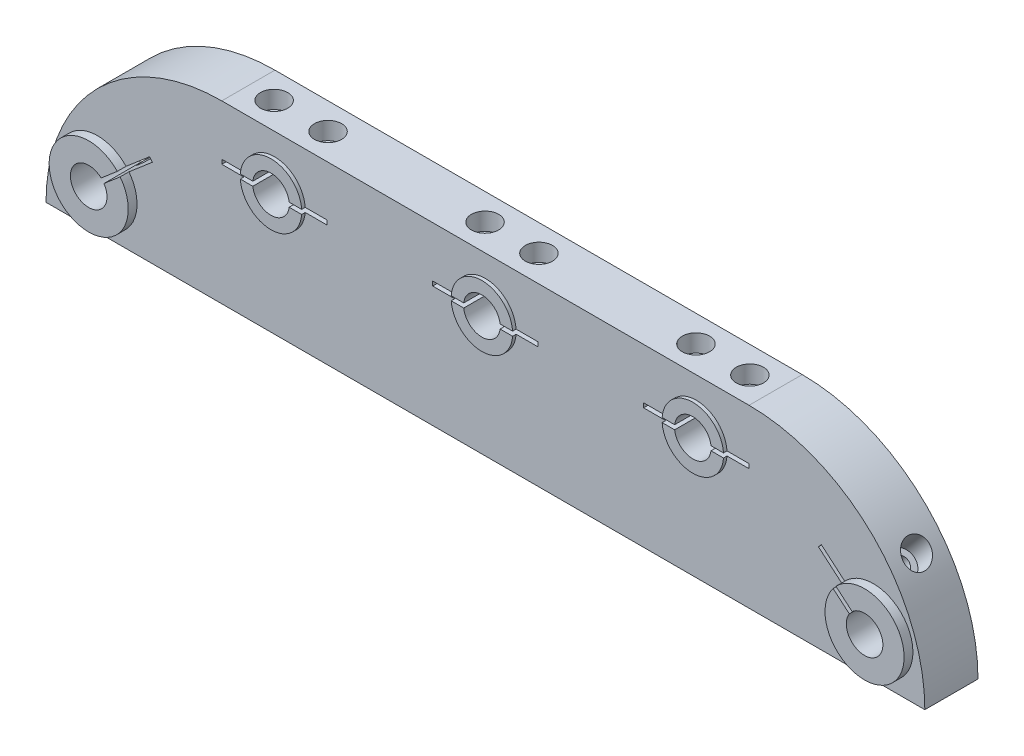
from build123d import *

# Parameters (mm, degrees)
SKETCH1_R                      = 4.165
BOSS_EXTRUDE1_DEPTH            = 12.1
SKETCH2_R                      = 7
SKETCH2_R_2                    = 4.165
BOSS_EXTRUDE3_DEPTH            = 0.8
SKETCH4_R                      = 9
SKETCH4_R_2                    = 4.165
BOSS_EXTRUDE4_DEPTH            = 2
CUT_EXTRUDE2_DEPTH             = 103.950522097
CUT_EXTRUDE2_DEPTH_BACK        = 103.950522097
SKETCH6_W                      = 24
SKETCH6_H                      = 1
CUT_EXTRUDE3_DEPTH             = 105.666422505
CUT_EXTRUDE3_DEPTH_BACK        = 105.666422505
SKETCH8_R                      = 1.6
CUT_EXTRUDE4_REACH             = 146.593
SKETCH9_R                      = 1.75
CUT_EXTRUDE4_DIRECTION_2_REACH = 146.593
CUT_EXTRUDE5_REACH             = 146.593
SKETCH10_R                     = 1.75
CUT_EXTRUDE5_DIRECTION_2_REACH = 146.593
SKETCH11_R                     = 3.1
CUT_EXTRUDE6_DEPTH             = 4
SKETCH12_R                     = 3.7
CUT_EXTRUDE7_DEPTH             = 20
CUT_EXTRUDE8_REACH             = 153.791
SKETCH13_R                     = 3.1
CUT_EXTRUDE9_REACH             = 140.366
SKETCH14_R                     = 3.6
CUT_EXTRUDE10_REACH            = 140.366
SKETCH15_R                     = 3.6
CUT_EXTRUDE11_REACH            = 153.791
SKETCH16_R                     = 3.1


with BuildPart() as part:
    # Sketch1 → Boss-Extrude1 (new body)
    with BuildSketch(Plane.XY):
        with BuildLine():
            Line((-60, 20), (60, 20))
            ThreePointArc((60, 20), (88.284271247, 8.284271247), (100, -20))
            Line((100, -20), (-100, -20))
            ThreePointArc((-100, -20), (-88.284271247, 8.284271247), (-60, 20))
        make_face()
        with Locations((0, 8)):
            Circle(SKETCH1_R, mode=Mode.SUBTRACT)
        with Locations((48, 8)):
            Circle(SKETCH1_R, mode=Mode.SUBTRACT)
        with Locations((-48, 8)):
            Circle(SKETCH1_R, mode=Mode.SUBTRACT)
        with Locations((-88.284271247, -10)):
            Circle(SKETCH1_R, mode=Mode.SUBTRACT)
        with Locations((88.284271247, -10)):
            Circle(SKETCH1_R, mode=Mode.SUBTRACT)
    extrude(amount=BOSS_EXTRUDE1_DEPTH)

    # Sketch2 → Boss-Extrude3 (add)
    # profile 1 of 3: a face of its own
    with BuildSketch(Plane.XY.offset(12.1)):
        with Locations((-48, 8)):
            Circle(SKETCH2_R)
        with Locations((-48, 8)):
            Circle(SKETCH2_R_2, mode=Mode.SUBTRACT)
    # profile 2 of 3: a face of its own
    with BuildSketch(Plane.XY.offset(12.1)):
        with Locations((0, 8)):
            Circle(SKETCH2_R)
        with Locations((0, 8)):
            Circle(SKETCH2_R_2, mode=Mode.SUBTRACT)
    # profile 3 of 3: a face of its own
    with BuildSketch(Plane.XY.offset(12.1)):
        with Locations((48, 8)):
            Circle(SKETCH2_R)
        with Locations((48, 8)):
            Circle(SKETCH2_R_2, mode=Mode.SUBTRACT)
    extrude(amount=BOSS_EXTRUDE3_DEPTH)

    # Sketch4 → Boss-Extrude4 (add)
    # profile 1 of 2: a face of its own
    with BuildSketch(Plane.XY.offset(12.1)):
        with Locations((-88.284271247, -10)):
            Circle(SKETCH4_R)
        with Locations((-88.284271247, -10)):
            Circle(SKETCH4_R_2, mode=Mode.SUBTRACT)
    # profile 2 of 2: a face of its own
    with BuildSketch(Plane.XY.offset(12.1)):
        with Locations((88.284271247, -10)):
            Circle(SKETCH4_R)
        with Locations((88.284271247, -10)):
            Circle(SKETCH4_R_2, mode=Mode.SUBTRACT)
    extrude(amount=BOSS_EXTRUDE4_DEPTH)

    # Sketch6 → Cut-Extrude2 (cut, two sides: drawn at the far end of the back side and taken through both)
    with BuildSketch(Plane(origin=(0, 0, 0), x_dir=(-1, 0, 0), z_dir=(0, 0, -1)).offset(-CUT_EXTRUDE2_DEPTH_BACK)):
        Polygon((87.959663189, -10.380301996), (88.608879306, -9.619698004), (76.439215423, 0.767759866), (75.789999307, 0.007155873), align=None)
        Polygon((-88.608879306, -9.619698004), (-87.959663189, -10.380301996), (-75.789999307, 0.007155873), (-76.439215423, 0.767759866), align=None)
        with Locations((-48, 8)):
            Rectangle(SKETCH6_W, SKETCH6_H)
        with Locations((0, 8)):
            Rectangle(SKETCH6_W, SKETCH6_H)
        with Locations((48, 8)):
            Rectangle(SKETCH6_W, SKETCH6_H)
    extrude(amount=CUT_EXTRUDE2_DEPTH + CUT_EXTRUDE2_DEPTH_BACK, mode=Mode.SUBTRACT)

    # Sketch8 → Cut-Extrude3 (cut, two sides: drawn at the far end of the back side and taken through both)
    with BuildSketch(Plane(origin=(0, 7.5, 0), x_dir=(1, 0, 0), z_dir=(0, 1, 0)).offset(-CUT_EXTRUDE3_DEPTH_BACK)):
        with Locations((54.134879079, -6.05)):
            Circle(SKETCH8_R)
        with Locations((41.865120921, -6.05)):
            Circle(SKETCH8_R)
        with Locations((6.134879079, -6.05)):
            Circle(SKETCH8_R)
        with Locations((-41.865120921, -6.05)):
            Circle(SKETCH8_R)
        with Locations((-6.134879079, -6.05)):
            Circle(SKETCH8_R)
        with Locations((-54.134879079, -6.05)):
            Circle(SKETCH8_R)
    extrude(amount=CUT_EXTRUDE3_DEPTH + CUT_EXTRUDE3_DEPTH_BACK, mode=Mode.SUBTRACT)

    # Sketch9 → Cut-Extrude4 (cut, up to next)
    with BuildSketch(Plane(origin=(31.947621166, 37.428966387, 0), x_dir=(0.76060399265734, -0.6492161168314546, 0), z_dir=(0.6492161168314546, 0.76060399265734, 0)), mode=Mode.PRIVATE) as cut_extrude4_sk1:
        with Locations((67.506651289, -6.05)):
            Circle(SKETCH9_R)
    cut_extrude4_tool1 = extrude(cut_extrude4_sk1.sketch, amount=-CUT_EXTRUDE4_REACH, mode=Mode.PRIVATE) & part.part
    add(cut_extrude4_tool1.solids().sort_by_distance((83.29345, -6.39744, 6.05))[0], mode=Mode.SUBTRACT)

    # Sketch9 → Cut-Extrude4 direction 2 (cut, up to next)
    with BuildSketch(Plane(origin=(31.947621166, 37.428966387, 0), x_dir=(0.76060399265734, -0.6492161168314546, 0), z_dir=(0.6492161168314546, 0.76060399265734, 0)), mode=Mode.PRIVATE) as cut_extrude4_direction_2_sk1:
        with Locations((67.506651289, -6.05)):
            Circle(SKETCH9_R)
    cut_extrude4_direction_2_tool1 = extrude(cut_extrude4_direction_2_sk1.sketch, amount=CUT_EXTRUDE4_DIRECTION_2_REACH, mode=Mode.PRIVATE) & part.part
    add(cut_extrude4_direction_2_tool1.solids().sort_by_distance((83.29345, -6.39744, 6.05))[0], mode=Mode.SUBTRACT)

    # Sketch10 → Cut-Extrude5 (cut, up to next)
    with BuildSketch(Plane(origin=(-31.947621166, 37.428966387, 0), x_dir=(0.7606039926573399, 0.6492161168314549, 0), z_dir=(-0.6492161168314549, 0.7606039926573399, 0)), mode=Mode.PRIVATE) as cut_extrude5_sk1:
        with Locations((-67.506651289, -6.05)):
            Circle(SKETCH10_R)
    cut_extrude5_tool1 = extrude(cut_extrude5_sk1.sketch, amount=-CUT_EXTRUDE5_REACH, mode=Mode.PRIVATE) & part.part
    add(cut_extrude5_tool1.solids().sort_by_distance((-83.29345, -6.39744, 6.05))[0], mode=Mode.SUBTRACT)

    # Sketch10 → Cut-Extrude5 direction 2 (cut, up to next)
    with BuildSketch(Plane(origin=(-31.947621166, 37.428966387, 0), x_dir=(0.7606039926573399, 0.6492161168314549, 0), z_dir=(-0.6492161168314549, 0.7606039926573399, 0)), mode=Mode.PRIVATE) as cut_extrude5_direction_2_sk1:
        with Locations((-67.506651289, -6.05)):
            Circle(SKETCH10_R)
    cut_extrude5_direction_2_tool1 = extrude(cut_extrude5_direction_2_sk1.sketch, amount=CUT_EXTRUDE5_DIRECTION_2_REACH, mode=Mode.PRIVATE) & part.part
    add(cut_extrude5_direction_2_tool1.solids().sort_by_distance((-83.29345, -6.39744, 6.05))[0], mode=Mode.SUBTRACT)

    # Sketch11 → Cut-Extrude6 (cut)
    with BuildSketch(Plane(origin=(0, 20, 0), x_dir=(1, 0, 0), z_dir=(0, 1, 0))):
        with Locations((-54.134879079, -6.05)):
            Circle(SKETCH11_R)
        with Locations((-41.865120921, -6.05)):
            Circle(SKETCH11_R)
        with Locations((-6.134879079, -6.05)):
            Circle(SKETCH11_R)
        with Locations((6.134879079, -6.05)):
            Circle(SKETCH11_R)
        with Locations((41.865120921, -6.05)):
            Circle(SKETCH11_R)
        with Locations((54.134879079, -6.05)):
            Circle(SKETCH11_R)
    extrude(amount=-CUT_EXTRUDE6_DEPTH, mode=Mode.SUBTRACT)

    # Sketch12 → Cut-Extrude7 (cut)
    with BuildSketch(Plane.XZ.offset(20)):
        with Locations((-54.134879079, 6.05)):
            Circle(SKETCH12_R)
        with Locations((-41.865120921, 6.05)):
            Circle(SKETCH12_R)
        with Locations((-6.134879079, 6.05)):
            Circle(SKETCH12_R)
        with Locations((6.134879079, 6.05)):
            Circle(SKETCH12_R)
        with Locations((41.865120921, 6.05)):
            Circle(SKETCH12_R)
        with Locations((54.134879079, 6.05)):
            Circle(SKETCH12_R)
    extrude(amount=-CUT_EXTRUDE7_DEPTH, mode=Mode.SUBTRACT)

    # Sketch13 → Cut-Extrude8 (cut, up to next)
    with BuildSketch(Plane(origin=(-37.1413501, 43.513798328, 0), x_dir=(-0.76060399265734, -0.6492161168314547, 0), z_dir=(0.6492161168314547, -0.76060399265734, 0)), mode=Mode.PRIVATE) as cut_extrude8_sk1:
        with Locations((67.506651289, -6.05)):
            Circle(SKETCH13_R)
    cut_extrude8_tool1 = extrude(cut_extrude8_sk1.sketch, amount=-CUT_EXTRUDE8_REACH, mode=Mode.PRIVATE) & part.part
    add(cut_extrude8_tool1.solids().sort_by_distance((-88.487179, -0.312608, 6.05))[0], mode=Mode.SUBTRACT)

    # Sketch14 → Cut-Extrude9 (cut, up to next)
    with BuildSketch(Plane(origin=(-27.403108348, 32.104738438, 0), x_dir=(0.76060399265734, 0.6492161168314547, 0), z_dir=(-0.6492161168314547, 0.76060399265734, 0)), mode=Mode.PRIVATE) as cut_extrude9_sk1:
        with Locations((-67.506651289, -6.05)):
            Circle(SKETCH14_R)
    cut_extrude9_tool1 = extrude(cut_extrude9_sk1.sketch, amount=-CUT_EXTRUDE9_REACH, mode=Mode.PRIVATE) & part.part
    add(cut_extrude9_tool1.solids().sort_by_distance((-78.748937, -11.721668, 6.05))[0], mode=Mode.SUBTRACT)

    # Sketch15 → Cut-Extrude10 (cut, up to next)
    with BuildSketch(Plane(origin=(27.403108348, 32.104738438, 0), x_dir=(0.76060399265734, -0.6492161168314547, 0), z_dir=(0.6492161168314547, 0.76060399265734, 0)), mode=Mode.PRIVATE) as cut_extrude10_sk1:
        with Locations((67.506651289, -6.05)):
            Circle(SKETCH15_R)
    cut_extrude10_tool1 = extrude(cut_extrude10_sk1.sketch, amount=-CUT_EXTRUDE10_REACH, mode=Mode.PRIVATE) & part.part
    add(cut_extrude10_tool1.solids().sort_by_distance((78.748937, -11.721668, 6.05))[0], mode=Mode.SUBTRACT)

    # Sketch16 → Cut-Extrude11 (cut, up to next)
    with BuildSketch(Plane(origin=(37.1413501, 43.513798328, 0), x_dir=(-0.7606039926573408, 0.6492161168314537, 0), z_dir=(-0.6492161168314537, -0.7606039926573408, 0)), mode=Mode.PRIVATE) as cut_extrude11_sk1:
        with Locations((-67.506651289, -6.05)):
            Circle(SKETCH16_R)
    cut_extrude11_tool1 = extrude(cut_extrude11_sk1.sketch, amount=-CUT_EXTRUDE11_REACH, mode=Mode.PRIVATE) & part.part
    add(cut_extrude11_tool1.solids().sort_by_distance((88.487179, -0.312608, 6.05))[0], mode=Mode.SUBTRACT)


solid = part.part
